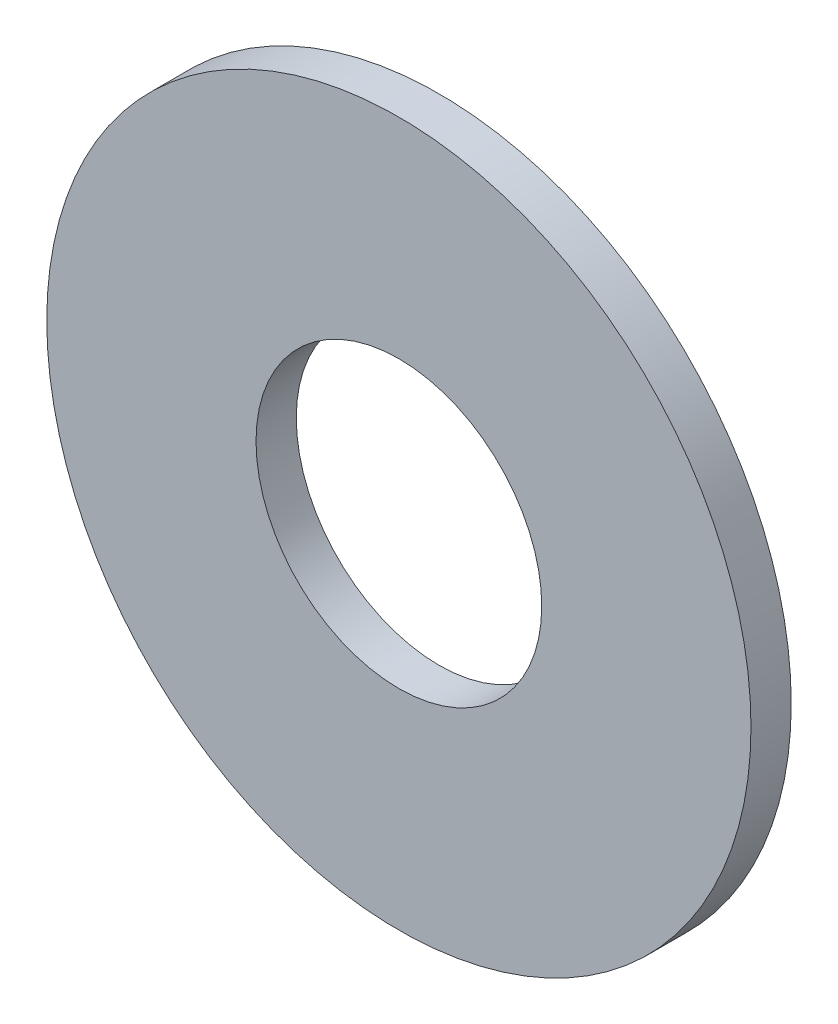
from build123d import *

# Parameters (mm, degrees)
ESQUISSE1_R      = 17.5
ESQUISSE1_R_2    = 7.1
EXTRUSION1_DEPTH = 2


with BuildPart() as part:
    # Esquisse1 → Extrusion1 (new body)
    with BuildSketch(Plane.XY):
        Circle(ESQUISSE1_R)
        Circle(ESQUISSE1_R_2, mode=Mode.SUBTRACT)
    extrude(amount=EXTRUSION1_DEPTH)


solid = part.part
